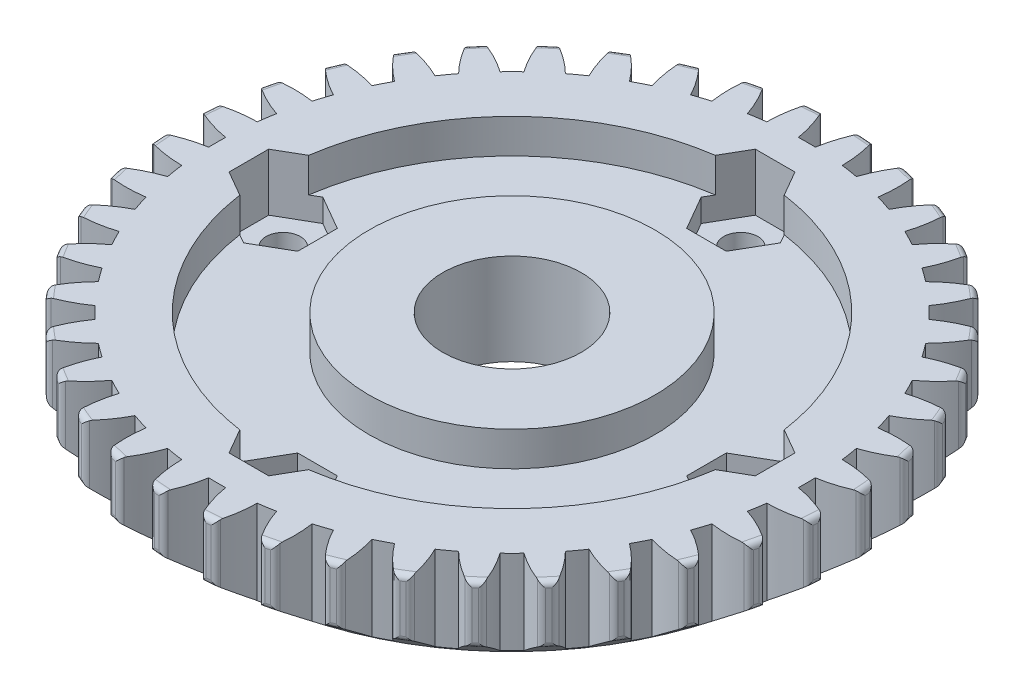
from build123d import *

# Parameters (mm, degrees)
SKETCH_2_R          = 1.5
SKETCH_2_R_2        = 6.05
EXTRUDE_2_DEPTH     = 8
SKETCH_3_R          = 12.5
CUT_EXTRUDE_1_DEPTH = 3
CUT_EXTRUDE_START   = -2
SKETCH_4_R          = 1.5
CUT_EXTRUDE_2_DEPTH = 2
FILLET_1_R          = 0.5


with BuildPart() as part:
    # 草图2 → 凸台-拉伸2 (new body)
    with BuildSketch(Plane(origin=(0, 0, 0), x_dir=(1, 0, 0), z_dir=(0, 1, 0))):
        with BuildLine():
            ThreePointArc((0.73985828, 25.769631348), (0, 25.78025), (-0.73985828, 25.769631348))
            ThreePointArc((-0.73985828, 25.769631348), (-1.118469833, 27.332605136), (-1.7209274, 28.823671416))
            ThreePointArc((-1.7209274, 28.823671416), (-2.265506389, 28.785988012), (-2.80927569, 28.738016548))
            ThreePointArc((-2.80927569, 28.738016548), (-3.17106185, 27.171062641), (-3.300509097, 25.568103758))
            ThreePointArc((-3.300509097, 25.568103758), (-4.032919617, 25.462852343), (-4.762007891, 25.336625089))
            ThreePointArc((-4.762007891, 25.336625089), (-5.380461076, 26.821128181), (-6.208755546, 28.199591833))
            ThreePointArc((-6.208755546, 28.199591833), (-6.740734881, 28.077181451), (-7.27030509, 27.944736336))
            ThreePointArc((-7.27030509, 27.944736336), (-7.382511465, 26.340478408), (-7.259606987, 24.737004598))
            ThreePointArc((-7.259606987, 24.737004598), (-7.966535369, 24.518474754), (-8.666901064, 24.279747034))
            ThreePointArc((-8.666901064, 24.279747034), (-9.50996751, 25.649226036), (-10.543703526, 26.881144711))
            ThreePointArc((-10.543703526, 26.881144711), (-11.04998411, 26.677021501), (-11.552315449, 26.463363973))
            ThreePointArc((-11.552315449, 26.463363973), (-11.412179147, 24.861304177), (-11.039949259, 23.296798287))
            ThreePointArc((-11.039949259, 23.296798287), (-11.703988581, 22.970370945), (-12.358386368, 22.625021026))
            ThreePointArc((-12.358386368, 22.625021026), (-13.405306983, 23.845754821), (-14.619030531, 24.900794592))
            ThreePointArc((-14.619030531, 24.900794592), (-15.087146056, 24.619984746), (-15.549869462, 24.330375762))
            ThreePointArc((-15.549869462, 24.330375762), (-15.160841103, 22.769962128), (-14.548451341, 21.282947485))
            ThreePointArc((-14.548451341, 21.282947485), (-15.15325075, 20.856660369), (-15.745567185, 20.413191913))
            ThreePointArc((-15.745567185, 20.413191913), (-16.970563308, 21.455121983), (-18.334388488, 22.30730427))
            ThreePointArc((-18.334388488, 22.30730427), (-18.752812396, 21.956722257), (-19.164534082, 21.598292951))
            ThreePointArc((-19.164534082, 21.598292951), (-18.536192836, 20.117948042), (-17.698722268, 18.745039881))
            ThreePointArc((-17.698722268, 18.745039881), (-18.229389596, 18.229389596), (-18.745039881, 17.698722268))
            ThreePointArc((-18.745039881, 17.698722268), (-20.117948042, 18.536192836), (-21.598292951, 19.164534082))
            ThreePointArc((-21.598292951, 19.164534082), (-21.956722257, 18.752812396), (-22.30730427, 18.334388488))
            ThreePointArc((-22.30730427, 18.334388488), (-21.455121983, 16.970563308), (-20.413191913, 15.745567185))
            ThreePointArc((-20.413191913, 15.745567185), (-20.856660369, 15.15325075), (-21.282947485, 14.548451341))
            ThreePointArc((-21.282947485, 14.548451341), (-22.769962128, 15.160841103), (-24.330375762, 15.549869462))
            ThreePointArc((-24.330375762, 15.549869462), (-24.619984746, 15.087146056), (-24.900794592, 14.619030531))
            ThreePointArc((-24.900794592, 14.619030531), (-23.845754821, 13.405306983), (-22.625021026, 12.358386368))
            ThreePointArc((-22.625021026, 12.358386368), (-22.970370945, 11.703988581), (-23.296798287, 11.039949259))
            ThreePointArc((-23.296798287, 11.039949259), (-24.861304177, 11.412179147), (-26.463363973, 11.552315449))
            ThreePointArc((-26.463363973, 11.552315449), (-26.677021501, 11.04998411), (-26.881144711, 10.543703526))
            ThreePointArc((-26.881144711, 10.543703526), (-25.649226036, 9.50996751), (-24.279747034, 8.666901064))
            ThreePointArc((-24.279747034, 8.666901064), (-24.518474754, 7.966535369), (-24.737004598, 7.259606987))
            ThreePointArc((-24.737004598, 7.259606987), (-26.340478408, 7.382511465), (-27.944736336, 7.27030509))
            ThreePointArc((-27.944736336, 7.27030509), (-28.077181451, 6.740734881), (-28.199591833, 6.208755546))
            ThreePointArc((-28.199591833, 6.208755546), (-26.821128181, 5.380461076), (-25.336625089, 4.762007891))
            ThreePointArc((-25.336625089, 4.762007891), (-25.462852343, 4.032919617), (-25.568103758, 3.300509097))
            ThreePointArc((-25.568103758, 3.300509097), (-27.171062641, 3.17106185), (-28.738016548, 2.80927569))
            ThreePointArc((-28.738016548, 2.80927569), (-28.785988012, 2.265506389), (-28.823671416, 1.7209274))
            ThreePointArc((-28.823671416, 1.7209274), (-27.332605136, 1.118469833), (-25.769631348, 0.73985828))
            ThreePointArc((-25.769631348, 0.73985828), (-25.78025, 0), (-25.769631348, -0.73985828))
            ThreePointArc((-25.769631348, -0.73985828), (-27.332605136, -1.118469833), (-28.823671416, -1.7209274))
            ThreePointArc((-28.823671416, -1.7209274), (-28.785988012, -2.265506389), (-28.738016548, -2.80927569))
            ThreePointArc((-28.738016548, -2.80927569), (-27.171062641, -3.17106185), (-25.568103758, -3.300509097))
            ThreePointArc((-25.568103758, -3.300509097), (-25.462852343, -4.032919617), (-25.336625089, -4.762007891))
            ThreePointArc((-25.336625089, -4.762007891), (-26.821128181, -5.380461076), (-28.199591833, -6.208755546))
            ThreePointArc((-28.199591833, -6.208755546), (-28.077181451, -6.740734881), (-27.944736336, -7.27030509))
            ThreePointArc((-27.944736336, -7.27030509), (-26.340478408, -7.382511465), (-24.737004598, -7.259606987))
            ThreePointArc((-24.737004598, -7.259606987), (-24.518474754, -7.966535369), (-24.279747034, -8.666901064))
            ThreePointArc((-24.279747034, -8.666901064), (-25.649226036, -9.50996751), (-26.881144711, -10.543703526))
            ThreePointArc((-26.881144711, -10.543703526), (-26.677021501, -11.04998411), (-26.463363973, -11.552315449))
            ThreePointArc((-26.463363973, -11.552315449), (-24.861304177, -11.412179147), (-23.296798287, -11.039949259))
            ThreePointArc((-23.296798287, -11.039949259), (-22.970370945, -11.703988581), (-22.625021026, -12.358386368))
            ThreePointArc((-22.625021026, -12.358386368), (-23.845754821, -13.405306983), (-24.900794592, -14.619030531))
            ThreePointArc((-24.900794592, -14.619030531), (-24.619984746, -15.087146056), (-24.330375762, -15.549869462))
            ThreePointArc((-24.330375762, -15.549869462), (-22.769962128, -15.160841103), (-21.282947485, -14.548451341))
            ThreePointArc((-21.282947485, -14.548451341), (-20.856660369, -15.15325075), (-20.413191913, -15.745567185))
            ThreePointArc((-20.413191913, -15.745567185), (-21.455121983, -16.970563308), (-22.30730427, -18.334388488))
            ThreePointArc((-22.30730427, -18.334388488), (-21.956722257, -18.752812396), (-21.598292951, -19.164534082))
            ThreePointArc((-21.598292951, -19.164534082), (-20.117948042, -18.536192836), (-18.745039881, -17.698722268))
            ThreePointArc((-18.745039881, -17.698722268), (-18.229389596, -18.229389596), (-17.698722268, -18.745039881))
            ThreePointArc((-17.698722268, -18.745039881), (-18.536192836, -20.117948042), (-19.164534082, -21.598292951))
            ThreePointArc((-19.164534082, -21.598292951), (-18.752812396, -21.956722257), (-18.334388488, -22.30730427))
            ThreePointArc((-18.334388488, -22.30730427), (-16.970563308, -21.455121983), (-15.745567185, -20.413191913))
            ThreePointArc((-15.745567185, -20.413191913), (-15.15325075, -20.856660369), (-14.548451341, -21.282947485))
            ThreePointArc((-14.548451341, -21.282947485), (-15.160841103, -22.769962128), (-15.549869462, -24.330375762))
            ThreePointArc((-15.549869462, -24.330375762), (-15.087146056, -24.619984746), (-14.619030531, -24.900794592))
            ThreePointArc((-14.619030531, -24.900794592), (-13.405306983, -23.845754821), (-12.358386368, -22.625021026))
            ThreePointArc((-12.358386368, -22.625021026), (-11.703988581, -22.970370945), (-11.039949259, -23.296798287))
            ThreePointArc((-11.039949259, -23.296798287), (-11.412179147, -24.861304177), (-11.552315449, -26.463363973))
            ThreePointArc((-11.552315449, -26.463363973), (-11.04998411, -26.677021501), (-10.543703526, -26.881144711))
            ThreePointArc((-10.543703526, -26.881144711), (-9.50996751, -25.649226036), (-8.666901064, -24.279747034))
            ThreePointArc((-8.666901064, -24.279747034), (-7.966535369, -24.518474754), (-7.259606987, -24.737004598))
            ThreePointArc((-7.259606987, -24.737004598), (-7.382511465, -26.340478408), (-7.27030509, -27.944736336))
            ThreePointArc((-7.27030509, -27.944736336), (-6.740734881, -28.077181451), (-6.208755546, -28.199591833))
            ThreePointArc((-6.208755546, -28.199591833), (-5.380461076, -26.821128181), (-4.762007891, -25.336625089))
            ThreePointArc((-4.762007891, -25.336625089), (-4.032919617, -25.462852343), (-3.300509097, -25.568103758))
            ThreePointArc((-3.300509097, -25.568103758), (-3.17106185, -27.171062641), (-2.80927569, -28.738016548))
            ThreePointArc((-2.80927569, -28.738016548), (-2.265506389, -28.785988012), (-1.7209274, -28.823671416))
            ThreePointArc((-1.7209274, -28.823671416), (-1.118469833, -27.332605136), (-0.73985828, -25.769631348))
            ThreePointArc((-0.73985828, -25.769631348), (0, -25.78025), (0.73985828, -25.769631348))
            ThreePointArc((0.73985828, -25.769631348), (1.118469833, -27.332605136), (1.7209274, -28.823671416))
            ThreePointArc((1.7209274, -28.823671416), (2.265506389, -28.785988012), (2.80927569, -28.738016548))
            ThreePointArc((2.80927569, -28.738016548), (3.17106185, -27.171062641), (3.300509097, -25.568103758))
            ThreePointArc((3.300509097, -25.568103758), (4.032919617, -25.462852343), (4.762007891, -25.336625089))
            ThreePointArc((4.762007891, -25.336625089), (5.380461076, -26.821128181), (6.208755546, -28.199591833))
            ThreePointArc((6.208755546, -28.199591833), (6.740734881, -28.077181451), (7.27030509, -27.944736336))
            ThreePointArc((7.27030509, -27.944736336), (7.382511465, -26.340478408), (7.259606987, -24.737004598))
            ThreePointArc((7.259606987, -24.737004598), (7.966535369, -24.518474754), (8.666901064, -24.279747034))
            ThreePointArc((8.666901064, -24.279747034), (9.50996751, -25.649226036), (10.543703526, -26.881144711))
            ThreePointArc((10.543703526, -26.881144711), (11.04998411, -26.677021501), (11.552315449, -26.463363973))
            ThreePointArc((11.552315449, -26.463363973), (11.412179147, -24.861304177), (11.039949259, -23.296798287))
            ThreePointArc((11.039949259, -23.296798287), (11.703988581, -22.970370945), (12.358386368, -22.625021026))
            ThreePointArc((12.358386368, -22.625021026), (13.405306983, -23.845754821), (14.619030531, -24.900794592))
            ThreePointArc((14.619030531, -24.900794592), (15.087146056, -24.619984746), (15.549869462, -24.330375762))
            ThreePointArc((15.549869462, -24.330375762), (15.160841103, -22.769962128), (14.548451341, -21.282947485))
            ThreePointArc((14.548451341, -21.282947485), (15.15325075, -20.856660369), (15.745567185, -20.413191913))
            ThreePointArc((15.745567185, -20.413191913), (16.970563308, -21.455121983), (18.334388488, -22.30730427))
            ThreePointArc((18.334388488, -22.30730427), (18.752812396, -21.956722257), (19.164534082, -21.598292951))
            ThreePointArc((19.164534082, -21.598292951), (18.536192836, -20.117948042), (17.698722268, -18.745039881))
            ThreePointArc((17.698722268, -18.745039881), (18.229389596, -18.229389596), (18.745039881, -17.698722268))
            ThreePointArc((18.745039881, -17.698722268), (20.117948042, -18.536192836), (21.598292951, -19.164534082))
            ThreePointArc((21.598292951, -19.164534082), (21.956722257, -18.752812396), (22.30730427, -18.334388488))
            ThreePointArc((22.30730427, -18.334388488), (21.455121983, -16.970563308), (20.413191913, -15.745567185))
            ThreePointArc((20.413191913, -15.745567185), (20.856660369, -15.15325075), (21.282947485, -14.548451341))
            ThreePointArc((21.282947485, -14.548451341), (22.769962128, -15.160841103), (24.330375762, -15.549869462))
            ThreePointArc((24.330375762, -15.549869462), (24.619984746, -15.087146056), (24.900794592, -14.619030531))
            ThreePointArc((24.900794592, -14.619030531), (23.845754821, -13.405306983), (22.625021026, -12.358386368))
            ThreePointArc((22.625021026, -12.358386368), (22.970370945, -11.703988581), (23.296798287, -11.039949259))
            ThreePointArc((23.296798287, -11.039949259), (24.861304177, -11.412179147), (26.463363973, -11.552315449))
            ThreePointArc((26.463363973, -11.552315449), (26.677021501, -11.04998411), (26.881144711, -10.543703526))
            ThreePointArc((26.881144711, -10.543703526), (25.649226036, -9.50996751), (24.279747034, -8.666901064))
            ThreePointArc((24.279747034, -8.666901064), (24.518474754, -7.966535369), (24.737004598, -7.259606987))
            ThreePointArc((24.737004598, -7.259606987), (26.340478408, -7.382511465), (27.944736336, -7.27030509))
            ThreePointArc((27.944736336, -7.27030509), (28.077181451, -6.740734881), (28.199591833, -6.208755546))
            ThreePointArc((28.199591833, -6.208755546), (26.821128181, -5.380461076), (25.336625089, -4.762007891))
            ThreePointArc((25.336625089, -4.762007891), (25.462852343, -4.032919617), (25.568103758, -3.300509097))
            ThreePointArc((25.568103758, -3.300509097), (27.171062641, -3.17106185), (28.738016548, -2.80927569))
            ThreePointArc((28.738016548, -2.80927569), (28.785988012, -2.265506389), (28.823671416, -1.7209274))
            ThreePointArc((28.823671416, -1.7209274), (27.332605136, -1.118469833), (25.769631348, -0.73985828))
            ThreePointArc((25.769631348, -0.73985828), (25.78025, 0), (25.769631348, 0.73985828))
            ThreePointArc((25.769631348, 0.73985828), (27.332605136, 1.118469833), (28.823671416, 1.7209274))
            ThreePointArc((28.823671416, 1.7209274), (28.785988012, 2.265506389), (28.738016548, 2.80927569))
            ThreePointArc((28.738016548, 2.80927569), (27.171062641, 3.17106185), (25.568103758, 3.300509097))
            ThreePointArc((25.568103758, 3.300509097), (25.462852343, 4.032919617), (25.336625089, 4.762007891))
            ThreePointArc((25.336625089, 4.762007891), (26.821128181, 5.380461076), (28.199591833, 6.208755546))
            ThreePointArc((28.199591833, 6.208755546), (28.077181451, 6.740734881), (27.944736336, 7.27030509))
            ThreePointArc((27.944736336, 7.27030509), (26.340478408, 7.382511465), (24.737004598, 7.259606987))
            ThreePointArc((24.737004598, 7.259606987), (24.518474754, 7.966535369), (24.279747034, 8.666901064))
            ThreePointArc((24.279747034, 8.666901064), (25.649226036, 9.50996751), (26.881144711, 10.543703526))
            ThreePointArc((26.881144711, 10.543703526), (26.677021501, 11.04998411), (26.463363973, 11.552315449))
            ThreePointArc((26.463363973, 11.552315449), (24.861304177, 11.412179147), (23.296798287, 11.039949259))
            ThreePointArc((23.296798287, 11.039949259), (22.970370945, 11.703988581), (22.625021026, 12.358386368))
            ThreePointArc((22.625021026, 12.358386368), (23.845754821, 13.405306983), (24.900794592, 14.619030531))
            ThreePointArc((24.900794592, 14.619030531), (24.619984746, 15.087146056), (24.330375762, 15.549869462))
            ThreePointArc((24.330375762, 15.549869462), (22.769962128, 15.160841103), (21.282947485, 14.548451341))
            ThreePointArc((21.282947485, 14.548451341), (20.856660369, 15.15325075), (20.413191913, 15.745567185))
            ThreePointArc((20.413191913, 15.745567185), (21.455121983, 16.970563308), (22.30730427, 18.334388488))
            ThreePointArc((22.30730427, 18.334388488), (21.956722257, 18.752812396), (21.598292951, 19.164534082))
            ThreePointArc((21.598292951, 19.164534082), (20.117948042, 18.536192836), (18.745039881, 17.698722268))
            ThreePointArc((18.745039881, 17.698722268), (18.229389596, 18.229389596), (17.698722268, 18.745039881))
            ThreePointArc((17.698722268, 18.745039881), (18.536192836, 20.117948042), (19.164534082, 21.598292951))
            ThreePointArc((19.164534082, 21.598292951), (18.752812396, 21.956722257), (18.334388488, 22.30730427))
            ThreePointArc((18.334388488, 22.30730427), (16.970563308, 21.455121983), (15.745567185, 20.413191913))
            ThreePointArc((15.745567185, 20.413191913), (15.15325075, 20.856660369), (14.548451341, 21.282947485))
            ThreePointArc((14.548451341, 21.282947485), (15.160841103, 22.769962128), (15.549869462, 24.330375762))
            ThreePointArc((15.549869462, 24.330375762), (15.087146056, 24.619984746), (14.619030531, 24.900794592))
            ThreePointArc((14.619030531, 24.900794592), (13.405306983, 23.845754821), (12.358386368, 22.625021026))
            ThreePointArc((12.358386368, 22.625021026), (11.703988581, 22.970370945), (11.039949259, 23.296798287))
            ThreePointArc((11.039949259, 23.296798287), (11.412179147, 24.861304177), (11.552315449, 26.463363973))
            ThreePointArc((11.552315449, 26.463363973), (11.04998411, 26.677021501), (10.543703526, 26.881144711))
            ThreePointArc((10.543703526, 26.881144711), (9.50996751, 25.649226036), (8.666901064, 24.279747034))
            ThreePointArc((8.666901064, 24.279747034), (7.966535369, 24.518474754), (7.259606987, 24.737004598))
            ThreePointArc((7.259606987, 24.737004598), (7.382511465, 26.340478408), (7.27030509, 27.944736336))
            ThreePointArc((7.27030509, 27.944736336), (6.740734881, 28.077181451), (6.208755546, 28.199591833))
            ThreePointArc((6.208755546, 28.199591833), (5.380461076, 26.821128181), (4.762007891, 25.336625089))
            ThreePointArc((4.762007891, 25.336625089), (4.032919617, 25.462852343), (3.300509097, 25.568103758))
            ThreePointArc((3.300509097, 25.568103758), (3.17106185, 27.171062641), (2.80927569, 28.738016548))
            ThreePointArc((2.80927569, 28.738016548), (2.265506389, 28.785988012), (1.7209274, 28.823671416))
            ThreePointArc((1.7209274, 28.823671416), (1.118469833, 27.332605136), (0.73985828, 25.769631348))
        make_face()
        with Locations((0, -20)):
            Circle(SKETCH_2_R, mode=Mode.SUBTRACT)
        with Locations((-20, 0)):
            Circle(SKETCH_2_R, mode=Mode.SUBTRACT)
        Circle(SKETCH_2_R_2, mode=Mode.SUBTRACT)
        with Locations((20, 0)):
            Circle(SKETCH_2_R, mode=Mode.SUBTRACT)
        with Locations((0, 20)):
            Circle(SKETCH_2_R, mode=Mode.SUBTRACT)
    extrude(amount=EXTRUDE_2_DEPTH)

    # 草图3 → 切除-拉伸1 (cut)
    with BuildSketch(Plane(origin=(0, 8, 0), x_dir=(1, 0, 0), z_dir=(0, 1, 0))):
        with BuildLine():
            ThreePointArc((-20.782856857, -3.012118998), (-14.849242405, -14.849242405), (-3.012118998, -20.782856857))
            Line((-3.012118998, -20.782856857), (-1.732050808, -23))
            Line((-1.732050808, -23), (1.732050808, -23))
            Line((1.732050808, -23), (3.012118998, -20.782856857))
            ThreePointArc((3.012118998, -20.782856857), (14.849242405, -14.849242405), (20.782856857, -3.012118998))
            Line((20.782856857, -3.012118998), (23, -1.732050808))
            Line((23, -1.732050808), (23, 1.732050808))
            Line((23, 1.732050808), (20.782856857, 3.012118998))
            ThreePointArc((20.782856857, 3.012118998), (14.849242405, 14.849242405), (3.012118998, 20.782856857))
            Line((3.012118998, 20.782856857), (1.732050808, 23))
            Line((1.732050808, 23), (-1.732050808, 23))
            Line((-1.732050808, 23), (-3.012118998, 20.782856857))
            ThreePointArc((-3.012118998, 20.782856857), (-14.849242405, 14.849242405), (-20.782856857, 3.012118998))
            Line((-20.782856857, 3.012118998), (-23, 1.732050808))
            Line((-23, 1.732050808), (-23, -1.732050808))
            Line((-23, -1.732050808), (-20.782856857, -3.012118998))
        make_face()
        Circle(SKETCH_3_R, mode=Mode.SUBTRACT)
    extrude(amount=-CUT_EXTRUDE_1_DEPTH, mode=Mode.SUBTRACT)

    # 草图4 → 切除-拉伸2 (cut)
    # profile 1 of 4: a face of its own
    with BuildSketch(Plane(origin=(0, 5, 0), x_dir=(1, 0, 0), z_dir=(0, 1, 0)).offset(CUT_EXTRUDE_START)):
        Polygon((-23, 1.732050808), (-23, -1.732050808), (-20, -3.464101615), (-17, -1.732050808), (-17, 1.732050808), (-20, 3.464101615), align=None)
        with Locations((-20, 0)):
            Circle(SKETCH_4_R, mode=Mode.SUBTRACT)
    # profile 2 of 4: a face of its own
    with BuildSketch(Plane(origin=(0, 5, 0), x_dir=(1, 0, 0), z_dir=(0, 1, 0)).offset(CUT_EXTRUDE_START)):
        Polygon((-3.464101615, -20), (-1.732050808, -23), (1.732050808, -23), (3.464101615, -20), (1.732050808, -17), (-1.732050808, -17), align=None)
        with Locations((0, -20)):
            Circle(SKETCH_4_R, mode=Mode.SUBTRACT)
    # profile 3 of 4: a face of its own
    with BuildSketch(Plane(origin=(0, 5, 0), x_dir=(1, 0, 0), z_dir=(0, 1, 0)).offset(CUT_EXTRUDE_START)):
        Polygon((1.732050808, 23), (-1.732050808, 23), (-3.464101615, 20), (-1.732050808, 17), (1.732050808, 17), (3.464101615, 20), align=None)
    # profile 4 of 4: a face of its own
    with BuildSketch(Plane(origin=(0, 5, 0), x_dir=(1, 0, 0), z_dir=(0, 1, 0)).offset(CUT_EXTRUDE_START)):
        Polygon((23, -1.732050808), (23, 1.732050808), (20, 3.464101615), (17, 1.732050808), (17, -1.732050808), (20, -3.464101615), align=None)
        with Locations((20, 0)):
            Circle(SKETCH_4_R, mode=Mode.SUBTRACT)
    extrude(amount=CUT_EXTRUDE_2_DEPTH, mode=Mode.SUBTRACT)

    # 草图6 → 切除-旋转2 (revolve, cut)
    with BuildSketch(Plane(origin=(0, 0, 0), x_dir=(0, 0, -1), z_dir=(1, 0, 0))):
        Polygon((-30, 4), (-30, 0), (-25, 0), align=None)
    revolve(axis=Axis((0, 0, 0), (0, -1, 0)), mode=Mode.SUBTRACT)

    # 圆角1
    fillet_1_edges = [part.edges().sort_by_distance(p)[0] for p in [
        (-6.740734881, 8, 28.077181451),
        (-6.208755546, 5.55, 28.199591833),
        (-6.740734829, 3.1, 28.077181236),
        (-7.27030509, 5.55, 27.944736336),
        (-11.04998411, 8, 26.677021501),
        (-10.543703526, 5.55, 26.881144711),
        (-11.049984024, 3.1, 26.677021296),
        (-11.552315449, 5.55, 26.463363973),
        (-15.087146056, 8, 24.619984746),
        (-14.619030531, 5.55, 24.900794592),
        (-15.08714594, 3.1, 24.619984557),
        (-15.549869462, 5.55, 24.330375762),
        (-18.752812396, 8, 21.956722257),
        (-18.334388488, 5.55, 22.30730427),
        (-18.752812251, 3.1, 21.956722088),
        (-19.164534082, 5.55, 21.598292951),
        (-21.956722257, 8, 18.752812396),
        (-21.598292951, 5.55, 19.164534082),
        (-21.956722087, 3.1, 18.752812252),
        (-22.30730427, 5.55, 18.334388488),
        (-24.619984746, 8, 15.087146056),
        (-24.330375762, 5.55, 15.549869462),
        (-24.619984556, 3.1, 15.087145941),
        (-24.900794592, 5.55, 14.619030531),
        (-26.677021501, 8, 11.04998411),
        (-26.463363973, 5.55, 11.552315449),
        (-26.677021296, 3.1, 11.049984025),
        (-26.881144711, 5.55, 10.543703526),
        (-28.077181451, 8, 6.740734881),
        (-27.944736336, 5.55, 7.27030509),
        (-28.077181235, 3.1, 6.74073483),
        (-28.199591833, 5.55, 6.208755546),
        (-28.785988012, 8, 2.265506389),
        (-28.738016548, 5.55, 2.80927569),
        (-28.78598779, 3.1, 2.265506372),
        (-28.823671416, 5.55, 1.7209274),
        (-28.785988012, 8, -2.265506389),
        (-28.823671416, 5.55, -1.7209274),
        (-28.78598779, 3.1, -2.265506371),
        (-28.738016548, 5.55, -2.80927569),
        (-28.077181451, 8, -6.740734881),
        (-28.199591833, 5.55, -6.208755546),
        (-28.077181236, 3.1, -6.740734829),
        (-27.944736336, 5.55, -7.27030509),
        (-26.677021501, 8, -11.04998411),
        (-26.881144711, 5.55, -10.543703526),
        (-26.677021296, 3.1, -11.049984024),
        (-26.463363973, 5.55, -11.552315449),
        (-24.619984746, 8, -15.087146056),
        (-24.900794592, 5.55, -14.619030531),
        (-24.619984557, 3.1, -15.08714594),
        (-24.330375762, 5.55, -15.549869462),
        (-21.956722257, 8, -18.752812396),
        (-22.30730427, 5.55, -18.334388488),
        (-21.956722088, 3.1, -18.752812251),
        (-21.598292951, 5.55, -19.164534082),
        (-18.752812396, 8, -21.956722257),
        (-19.164534082, 5.55, -21.598292951),
        (-18.752812252, 3.1, -21.956722087),
        (-18.334388488, 5.55, -22.30730427),
        (-15.087146056, 8, -24.619984746),
        (-15.549869462, 5.55, -24.330375762),
        (-15.087145941, 3.1, -24.619984556),
        (-14.619030531, 5.55, -24.900794592),
        (-11.04998411, 8, -26.677021501),
        (-11.552315449, 5.55, -26.463363973),
        (-11.049984025, 3.1, -26.677021296),
        (-10.543703526, 5.55, -26.881144711),
        (-6.740734881, 8, -28.077181451),
        (-7.27030509, 5.55, -27.944736336),
        (-6.74073483, 3.1, -28.077181235),
        (-6.208755546, 5.55, -28.199591833),
        (-2.265506389, 8, -28.785988012),
        (-2.80927569, 5.55, -28.738016548),
        (-2.265506372, 3.1, -28.78598779),
        (-1.7209274, 5.55, -28.823671416),
        (2.265506389, 8, -28.785988012),
        (1.7209274, 5.55, -28.823671416),
        (2.265506371, 3.1, -28.78598779),
        (2.80927569, 5.55, -28.738016548),
        (6.740734881, 8, -28.077181451),
        (6.208755546, 5.55, -28.199591833),
        (6.740734829, 3.1, -28.077181236),
        (7.27030509, 5.55, -27.944736336),
        (11.04998411, 8, -26.677021501),
        (10.543703526, 5.55, -26.881144711),
        (11.049984024, 3.1, -26.677021296),
        (11.552315449, 5.55, -26.463363973),
        (15.087146056, 8, -24.619984746),
        (14.619030531, 5.55, -24.900794592),
        (15.08714594, 3.1, -24.619984557),
        (15.549869462, 5.55, -24.330375762),
        (18.752812396, 8, -21.956722257),
        (18.334388488, 5.55, -22.30730427),
        (18.752812251, 3.1, -21.956722088),
        (19.164534082, 5.55, -21.598292951),
        (21.956722257, 8, -18.752812396),
        (21.598292951, 5.55, -19.164534082),
        (21.956722087, 3.1, -18.752812252),
        (22.30730427, 5.55, -18.334388488),
        (24.619984746, 8, -15.087146056),
        (24.330375762, 5.55, -15.549869462),
        (24.619984556, 3.1, -15.087145941),
        (24.900794592, 5.55, -14.619030531),
        (26.677021501, 8, -11.04998411),
        (26.463363973, 5.55, -11.552315449),
        (26.677021296, 3.1, -11.049984025),
        (26.881144711, 5.55, -10.543703526),
        (28.077181451, 8, -6.740734881),
        (27.944736336, 5.55, -7.27030509),
        (28.077181235, 3.1, -6.74073483),
        (28.199591833, 5.55, -6.208755546),
        (28.785988012, 8, -2.265506389),
        (28.738016548, 5.55, -2.80927569),
        (28.78598779, 3.1, -2.265506372),
        (28.823671416, 5.55, -1.7209274),
        (28.785988012, 8, 2.265506389),
        (28.823671416, 5.55, 1.7209274),
        (28.78598779, 3.1, 2.265506371),
        (28.738016548, 5.55, 2.80927569),
        (28.077181451, 8, 6.740734881),
        (28.199591833, 5.55, 6.208755546),
        (28.077181236, 3.1, 6.740734829),
        (27.944736336, 5.55, 7.27030509),
        (26.677021501, 8, 11.04998411),
        (26.881144711, 5.55, 10.543703526),
        (26.677021296, 3.1, 11.049984024),
        (26.463363973, 5.55, 11.552315449),
        (-2.265506389, 8, 28.785988012),
        (-1.7209274, 5.55, 28.823671416),
        (-2.265506371, 3.1, 28.78598779),
        (-2.80927569, 5.55, 28.738016548),
        (2.265506389, 8, 28.785988012),
        (2.80927569, 5.55, 28.738016548),
        (2.265506372, 3.1, 28.78598779),
        (1.7209274, 5.55, 28.823671416),
        (6.740734881, 8, 28.077181451),
        (7.27030509, 5.55, 27.944736336),
        (6.74073483, 3.1, 28.077181235),
        (6.208755546, 5.55, 28.199591833),
        (11.04998411, 8, 26.677021501),
        (11.552315449, 5.55, 26.463363973),
        (11.049984025, 3.1, 26.677021296),
        (10.543703526, 5.55, 26.881144711),
        (15.087146056, 8, 24.619984746),
        (15.549869462, 5.55, 24.330375762),
        (15.087145941, 3.1, 24.619984556),
        (14.619030531, 5.55, 24.900794592),
        (18.752812396, 8, 21.956722257),
        (19.164534082, 5.55, 21.598292951),
        (18.752812252, 3.1, 21.956722087),
        (18.334388488, 5.55, 22.30730427),
        (21.956722257, 8, 18.752812396),
        (22.30730427, 5.55, 18.334388488),
        (21.956722088, 3.1, 18.752812251),
        (21.598292951, 5.55, 19.164534082),
        (24.619984746, 8, 15.087146056),
        (24.900794592, 5.55, 14.619030531),
        (24.619984557, 3.1, 15.08714594),
        (24.330375762, 5.55, 15.549869462),
    ]]
    fillet(fillet_1_edges, radius=FILLET_1_R)


solid = part.part
